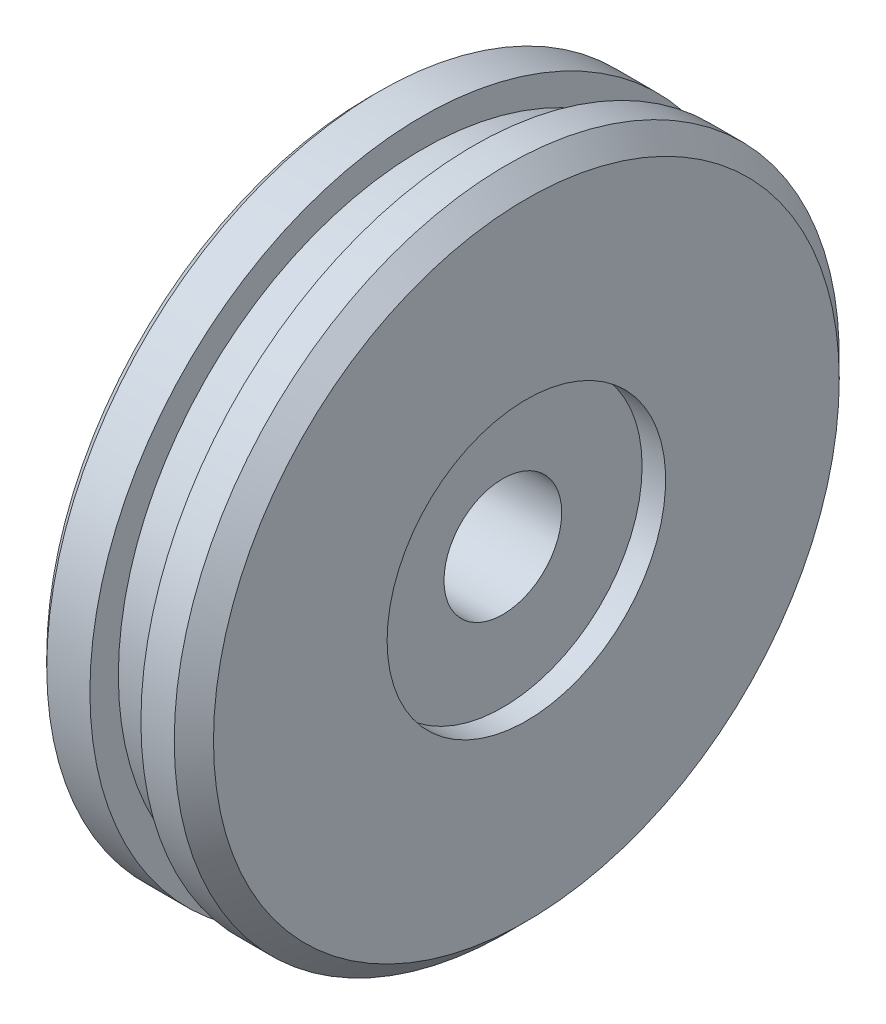
from build123d import *

# Parameters (mm, degrees)
SKETCH2_W            = 2.6
SKETCH2_H            = 2.45
BOSS_EXTRUDE1_START  = -55.3
SKETCH3_W            = 2.3
SKETCH3_H            = 23
BOSS_EXTRUDE1_DEPTH  = 6.6
BOSS_EXTRUDE2_START  = -63.5
SKETCH4_W            = 2.3
SKETCH4_H            = 6.6
BOSS_EXTRUDE2_DEPTH  = 23
BOSS_EXTRUDE3_START  = 76.7
SKETCH5_R            = 4.6
BOSS_EXTRUDE3_DEPTH  = 2.3
BOSS_EXTRUDE4_START  = 84
SKETCH6_R            = 7.1
BOSS_EXTRUDE4_DEPTH  = 1.7
BOSS_EXTRUDE5_START  = 78.9
SKETCH7_R            = 3
BOSS_EXTRUDE5_DEPTH  = 5.2
BOSS_EXTRUDE6_START  = -52.9
SKETCH8_W            = 4.1
SKETCH8_H            = 2.1
BOSS_EXTRUDE6_DEPTH  = 1.8
BOSS_EXTRUDE7_START  = -46.5
SKETCH9_W            = 4.1
SKETCH9_H            = 1.8
BOSS_EXTRUDE7_DEPTH  = 2.1
BOSS_EXTRUDE8_START  = -52.9
SKETCH10_W           = 4.1
SKETCH10_H           = 2.1
BOSS_EXTRUDE8_DEPTH  = 1.8
BOSS_EXTRUDE9_START  = -59.6
SKETCH11_W           = 4.1
SKETCH11_H           = 1.8
BOSS_EXTRUDE9_DEPTH  = 2.1
BOSS_EXTRUDE10_START = -52.9
SKETCH12_W           = 5.3
SKETCH12_H           = 2.4
BOSS_EXTRUDE10_DEPTH = 1.8
BOSS_EXTRUDE11_START = -44.4
SKETCH13_W           = 5.3
SKETCH13_H           = 1.8
BOSS_EXTRUDE11_DEPTH = 2.4
BOSS_EXTRUDE12_START = -52.9
SKETCH14_W           = 5.3
SKETCH14_H           = 2.4
BOSS_EXTRUDE12_DEPTH = 1.8
BOSS_EXTRUDE13_START = -62
SKETCH15_W           = 5.3
SKETCH15_H           = 1.8
BOSS_EXTRUDE13_DEPTH = 2.4


with BuildPart() as part:
    # Sketch1 → Revolve1 (revolve)
    with BuildSketch(Plane.XY.offset(-52)):
        Polygon((77.2, -65), (85.2, -65), (85.2, -49.05), (84.2, -48.05), (77.7, -48.05), (77.2, -48.55), align=None)
    revolve(axis=Axis((72.2, -65, -52), (1, 0, 0)))


with BuildPart() as body_2:
    # Sketch2 → Revolve2 (revolve)
    with BuildSketch(Plane.XY.offset(-52)):
        with Locations((81.2, -48.275)):
            Rectangle(SKETCH2_W, SKETCH2_H)
    revolve(axis=Axis((74.9, -65, -52), (1, 0, 0)))


with BuildPart() as part_1:
    add(part.part)

    # Combine1: cut body 2
    add(body_2.part, mode=Mode.SUBTRACT)


with BuildPart() as body_2_2:
    # Sketch3 → Boss-Extrude1 (new body)
    with BuildSketch(Plane.XY.offset(BOSS_EXTRUDE1_START)):
        with Locations((77.85, -65)):
            Rectangle(SKETCH3_W, SKETCH3_H)
    extrude(amount=BOSS_EXTRUDE1_DEPTH)


with BuildPart() as part_2:
    add(part_1.part)

    # Combine2: cut body 2 2
    add(body_2_2.part, mode=Mode.SUBTRACT)


with BuildPart() as body_2_3:
    # Sketch4 → Boss-Extrude2 (new body)
    with BuildSketch(Plane.XY.offset(BOSS_EXTRUDE2_START)):
        with Locations((77.85, -65)):
            Rectangle(SKETCH4_W, SKETCH4_H)
    extrude(amount=BOSS_EXTRUDE2_DEPTH)


with BuildPart() as part_3:
    add(part_2.part)

    # Combine3: cut body 2 3
    add(body_2_3.part, mode=Mode.SUBTRACT)


with BuildPart() as body_2_4:
    # Sketch5 → Boss-Extrude3 (new body)
    with BuildSketch(Plane(origin=(0, 0, 0), x_dir=(0, 0, -1), z_dir=(1, 0, 0)).offset(BOSS_EXTRUDE3_START)):
        with Locations((52, -65)):
            Circle(SKETCH5_R)
    extrude(amount=BOSS_EXTRUDE3_DEPTH)


with BuildPart() as part_4:
    add(part_3.part)

    # Combine4: cut body 2 4
    add(body_2_4.part, mode=Mode.SUBTRACT)


with BuildPart() as body_2_5:
    # Sketch6 → Boss-Extrude4 (new body)
    with BuildSketch(Plane(origin=(0, 0, 0), x_dir=(0, 0, -1), z_dir=(1, 0, 0)).offset(BOSS_EXTRUDE4_START)):
        with Locations((52, -65)):
            Circle(SKETCH6_R)
    extrude(amount=BOSS_EXTRUDE4_DEPTH)


with BuildPart() as part_5:
    add(part_4.part)

    # Combine5: cut body 2 5
    add(body_2_5.part, mode=Mode.SUBTRACT)


with BuildPart() as body_2_6:
    # Sketch7 → Boss-Extrude5 (new body)
    with BuildSketch(Plane(origin=(0, 0, 0), x_dir=(0, 0, -1), z_dir=(1, 0, 0)).offset(BOSS_EXTRUDE5_START)):
        with Locations((52, -65)):
            Circle(SKETCH7_R)
    extrude(amount=BOSS_EXTRUDE5_DEPTH)


with BuildPart() as part_6:
    add(part_5.part)

    # Combine6: cut body 2 6
    add(body_2_6.part, mode=Mode.SUBTRACT)


with BuildPart() as body_2_7:
    # Sketch8 → Boss-Extrude6 (new body)
    with BuildSketch(Plane.XY.offset(BOSS_EXTRUDE6_START)):
        with Locations((80.95, -58.45)):
            Rectangle(SKETCH8_W, SKETCH8_H)
    extrude(amount=BOSS_EXTRUDE6_DEPTH)


with BuildPart() as part_7:
    add(part_6.part)

    # Combine7: cut body 2 7
    add(body_2_7.part, mode=Mode.SUBTRACT)


with BuildPart() as body_2_8:
    # Sketch9 → Boss-Extrude7 (new body)
    with BuildSketch(Plane.XY.offset(BOSS_EXTRUDE7_START)):
        with Locations((80.95, -65)):
            Rectangle(SKETCH9_W, SKETCH9_H)
    extrude(amount=BOSS_EXTRUDE7_DEPTH)


with BuildPart() as part_8:
    add(part_7.part)

    # Combine8: cut body 2 8
    add(body_2_8.part, mode=Mode.SUBTRACT)


with BuildPart() as body_2_9:
    # Sketch10 → Boss-Extrude8 (new body)
    with BuildSketch(Plane.XY.offset(BOSS_EXTRUDE8_START)):
        with Locations((80.95, -71.55)):
            Rectangle(SKETCH10_W, SKETCH10_H)
    extrude(amount=BOSS_EXTRUDE8_DEPTH)


with BuildPart() as part_9:
    add(part_8.part)

    # Combine9: cut body 2 9
    add(body_2_9.part, mode=Mode.SUBTRACT)


with BuildPart() as body_2_10:
    # Sketch11 → Boss-Extrude9 (new body)
    with BuildSketch(Plane.XY.offset(BOSS_EXTRUDE9_START)):
        with Locations((80.95, -65)):
            Rectangle(SKETCH11_W, SKETCH11_H)
    extrude(amount=BOSS_EXTRUDE9_DEPTH)


with BuildPart() as part_10:
    add(part_9.part)

    # Combine10: cut body 2 10
    add(body_2_10.part, mode=Mode.SUBTRACT)


with BuildPart() as body_2_11:
    # Sketch12 → Boss-Extrude10 (new body)
    with BuildSketch(Plane.XY.offset(BOSS_EXTRUDE10_START)):
        with Locations((81.55, -56.2)):
            Rectangle(SKETCH12_W, SKETCH12_H)
    extrude(amount=BOSS_EXTRUDE10_DEPTH)


with BuildPart() as part_11:
    add(part_10.part)

    # Combine11: cut body 2 11
    add(body_2_11.part, mode=Mode.SUBTRACT)


with BuildPart() as body_2_12:
    # Sketch13 → Boss-Extrude11 (new body)
    with BuildSketch(Plane.XY.offset(BOSS_EXTRUDE11_START)):
        with Locations((81.55, -65)):
            Rectangle(SKETCH13_W, SKETCH13_H)
    extrude(amount=BOSS_EXTRUDE11_DEPTH)


with BuildPart() as part_12:
    add(part_11.part)

    # Combine12: cut body 2 12
    add(body_2_12.part, mode=Mode.SUBTRACT)


with BuildPart() as body_2_13:
    # Sketch14 → Boss-Extrude12 (new body)
    with BuildSketch(Plane.XY.offset(BOSS_EXTRUDE12_START)):
        with Locations((81.55, -73.8)):
            Rectangle(SKETCH14_W, SKETCH14_H)
    extrude(amount=BOSS_EXTRUDE12_DEPTH)


with BuildPart() as part_13:
    add(part_12.part)

    # Combine13: cut body 2 13
    add(body_2_13.part, mode=Mode.SUBTRACT)


with BuildPart() as body_2_14:
    # Sketch15 → Boss-Extrude13 (new body)
    with BuildSketch(Plane.XY.offset(BOSS_EXTRUDE13_START)):
        with Locations((81.55, -65)):
            Rectangle(SKETCH15_W, SKETCH15_H)
    extrude(amount=BOSS_EXTRUDE13_DEPTH)


with BuildPart() as part_14:
    add(part_13.part)

    # Combine14: cut body 2 14
    add(body_2_14.part, mode=Mode.SUBTRACT)


solid = part_14.part
